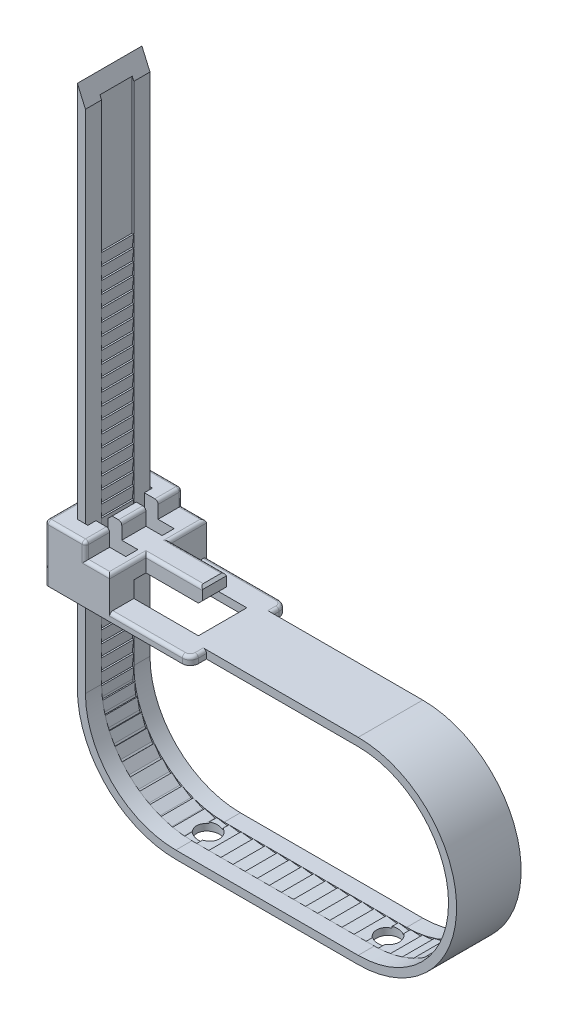
from build123d import *

# Parameters (mm, degrees)
EXTRUDE_1_DEPTH       = 8
SKETCH_2_W            = 18
SKETCH_2_H            = 12
SKETCH_2_W_2          = 1.3
SKETCH_2_H_2          = 8
EXTRUDE_2_DEPTH       = 1
FILLET_1_R            = 1
SKETCH_3_W            = 8
SKETCH_3_H            = 12
EXTRUDE_3_DEPTH       = 4
SKETCH_4_W            = 5
SKETCH_4_H            = 12
SKETCH_4_W_2          = 1.3
SKETCH_4_H_2          = 8
EXTRUDE_4_DEPTH       = 2
CUT_EXTRUDE_START     = -7
CUT_EXTRUDE_1_DEPTH   = 7
SKETCH_6_W            = 12.7
SKETCH_6_H            = 6
CUT_EXTRUDE_2_DEPTH   = 3
SKETCH_7_W            = 3
SKETCH_7_H            = 2
EXTRUDE_5_DEPTH       = 7
CHAMFER_1_SIZE        = 0.3
FILLET_2_R            = 0.4
CHAMFER_2_SIZE        = 0.5
SKETCH_12_W           = 0.2
SKETCH_12_H           = 4
EXTRUDE_6_REACH       = 82.751
PATTERN_START         = 2
PATTERN_CURVE_3_DEPTH = 4
CHAMFER_4_SIZE        = 0.5
CUT_EXTRUDE_3_REACH   = 83.915
SKETCH_15_R           = 1.4


# Read off the part's stored shape, not the designer's step: 曲线阵列3
with BuildPart() as part:
    # 草图1 → 凸台-拉伸1 (new body)
    with BuildSketch(Plane.XY):
        with BuildLine():
            Line((11.3, 0), (-11.3, 0))
            ThreePointArc((-11.3, 0), (-19.219595949, 3.280404051), (-22.5, 11.2))
            Line((-22.5, 11.2), (-22.5, 73.908712153))
            Line((-22.5, 73.908712153), (-23.5, 76.2))
            Line((-23.5, 76.2), (-23.5, 11.2))
            ThreePointArc((-23.5, 11.2), (-19.92670273, 2.57329727), (-11.3, -1))
            Line((-11.3, -1), (11.3, -1))
            ThreePointArc((11.3, -1), (23.5, 11.2), (11.3, 23.4))
            Line((11.3, 23.4), (-7.5, 23.4))
            Line((-7.5, 23.4), (-7.5, 22.4))
            Line((-7.5, 22.4), (11.3, 22.4))
            ThreePointArc((11.3, 22.4), (22.5, 11.2), (11.3, 0))
        make_face()
    extrude(amount=EXTRUDE_1_DEPTH)

    # 草图2 → 凸台-拉伸2 (add)
    with BuildSketch(Plane.XZ.offset(-22.4)):
        with Locations((-16.5, 4)):
            Rectangle(SKETCH_2_W, SKETCH_2_H)
        with Locations((-22.85, 4)):
            Rectangle(SKETCH_2_W_2, SKETCH_2_H_2, mode=Mode.SUBTRACT)
    extrude(amount=-EXTRUDE_2_DEPTH)

    # 圆角1
    fillet_1_edges = [part.edges().sort_by_distance(p)[0] for p in [
        (-7.5, 22.9, 10),
        (-7.5, 22.9, -2),
    ]]
    fillet(fillet_1_edges, radius=FILLET_1_R)

    # 草图3 → 凸台-拉伸3 (add)
    with BuildSketch(Plane(origin=(0, 23.4, 0), x_dir=(1, 0, 0), z_dir=(0, 1, 0))):
        with Locations((-21.5, -4)):
            Rectangle(SKETCH_3_W, SKETCH_3_H)
        Polygon((-22.5, 0), (-22.2, 0), (-22.2, -8), (-22.5, -8), (-23.5, -8), (-23.5, 0), align=None, mode=Mode.SUBTRACT)
    extrude(amount=EXTRUDE_3_DEPTH)

    # 草图4 → 凸台-拉伸4 (add)
    with BuildSketch(Plane(origin=(0, 27.4, 0), x_dir=(1, 0, 0), z_dir=(0, 1, 0))):
        with Locations((-23, -4)):
            Rectangle(SKETCH_4_W, SKETCH_4_H)
        with Locations((-22.85, -4)):
            Rectangle(SKETCH_4_W_2, SKETCH_4_H_2, mode=Mode.SUBTRACT)
    extrude(amount=EXTRUDE_4_DEPTH)

    # 草图5 → 切除-拉伸1 (cut)
    with BuildSketch(Plane(origin=(0, 29.4, 0), x_dir=(1, 0, 0), z_dir=(0, 1, 0)).offset(CUT_EXTRUDE_START)):
        Polygon((-22.2, 0), (-22.5, 0), (-22.5, -8), (-22.2, -8), (-22.2, -7), (-18.5, -7), (-18.5, -5.5), (-22.2, -5.5), (-22.2, -2.5), (-18.5, -2.5), (-18.5, -1), (-22.2, -1), align=None)
    extrude(amount=CUT_EXTRUDE_1_DEPTH, mode=Mode.SUBTRACT)

    # 草图6 → 切除-拉伸2 (cut)
    with BuildSketch(Plane.XZ.offset(-22.4)):
        with Locations((-15.85, 4)):
            Rectangle(SKETCH_6_W, SKETCH_6_H)
    extrude(amount=-CUT_EXTRUDE_2_DEPTH, mode=Mode.SUBTRACT)

    # 草图7 → 凸台-拉伸5 (add)
    with BuildSketch(Plane(origin=(-17.5, 0, 0), x_dir=(0, 0, -1), z_dir=(1, 0, 0))):
        with Locations((-4, 26.4)):
            Rectangle(SKETCH_7_W, SKETCH_7_H)
    extrude(amount=EXTRUDE_5_DEPTH)

    # 倒角1
    chamfer_1_edges = [part.edges().sort_by_distance(p)[0] for p in [
        (-10.5, 27.4, 4),
    ]]
    chamfer(chamfer_1_edges, length=CHAMFER_1_SIZE)

    # 圆角2
    fillet_2_edges = [part.edges().sort_by_distance(p)[0] for p in [
        (-7.5, 23.4, -0.5),
        (-7.792893219, 23.4, -1.707106781),
        (-7.5, 23.4, 8.5),
        (-7.792893219, 23.4, 9.707106781),
        (-25.5, 25.9, 10),
        (-25.5, 25.9, -2),
        (-25.5, 29.4, 4),
        (-20.5, 28.4, 10),
        (-19, 27.4, 10),
        (-23, 29.4, 10),
        (-20.5, 29.4, 8.5),
        (-20.5, 29.4, 4),
        (-20.5, 28.4, -2),
        (-19, 27.4, -2),
        (-23, 29.4, -2),
        (-20.5, 29.4, -0.5),
        (-13, 23.4, -2),
        (-13, 23.4, 10),
        (-14.15, 27.4, 5.5),
        (-14.15, 27.4, 2.5),
        (-17.5, 27.4, 0.25),
        (-17.5, 27.4, 7.75),
    ]]
    fillet(fillet_2_edges, radius=FILLET_2_R)

    # 倒角2
    chamfer_2_edges = [part.edges().sort_by_distance(p)[0] for p in [
        (-10.5, 25.4, 4),
    ]]
    chamfer(chamfer_2_edges, length=CHAMFER_2_SIZE)

    # 切除-扫描3: sweep along a path in 草图11
    with BuildLine(Plane(origin=(0, 0, 0), x_dir=(-1, 0, 0), z_dir=(0, 0, -1))) as sweep_3_path:
        Line((9.562737591, 22.4), (-11.3, 22.4))
        ThreePointArc((-11.3, 22.4), (-22.5, 11.2), (-11.3, 0))
        Line((-11.3, 0), (11.3, 0))
        ThreePointArc((11.3, 0), (19.219595949, 3.280404051), (22.5, 11.2))
        Line((22.5, 11.2), (22.5, 76.2))
    # 草图12 → 切除-扫描3 (sweep, cut)
    with BuildSketch(Plane(origin=(0, 76.2, 0), x_dir=(-1, 0, 0), z_dir=(0, -1, 0))):
        with Locations((22.6, -4)):
            Rectangle(SKETCH_12_W, SKETCH_12_H)
    sweep(path=sweep_3_path.line, mode=Mode.SUBTRACT)

    # 草图14 → 凸台-拉伸6 (add, up to next)
    with BuildSketch(Plane(origin=(0, 0, 6), x_dir=(-1, 0, 0), z_dir=(0, 0, -1)), mode=Mode.PRIVATE) as extrude_6_sk1:
        Polygon((8, 22.6), (8, 22.4), (9.5, 22.6), align=None)
    extrude_6_tool1 = extrude(extrude_6_sk1.sketch, amount=EXTRUDE_6_REACH, mode=Mode.PRIVATE) - part.part
    add(extrude_6_tool1.solids().sort_by_distance((-8.5, 22.533333, 6))[0])

    # 曲线阵列3 outline → 曲线阵列3 (add)
    with BuildSketch(Plane.XY.offset(PATTERN_START)):
        Polygon((-22.7, 57.52124342), (-22.7, 56.02124342), (-22.5, 57.52124342), align=None)
        Polygon((-22.7, 56.02124342), (-22.7, 54.52124342), (-22.5, 56.02124342), align=None)
        Polygon((-22.7, 54.52124342), (-22.7, 53.02124342), (-22.5, 54.52124342), align=None)
        Polygon((-22.7, 53.02124342), (-22.7, 51.52124342), (-22.5, 53.02124342), align=None)
        Polygon((-22.7, 51.52124342), (-22.7, 50.02124342), (-22.5, 51.52124342), align=None)
        Polygon((-22.7, 50.02124342), (-22.7, 48.52124342), (-22.5, 50.02124342), align=None)
        Polygon((-22.7, 48.52124342), (-22.7, 47.02124342), (-22.5, 48.52124342), align=None)
        Polygon((-22.7, 47.02124342), (-22.7, 45.52124342), (-22.5, 47.02124342), align=None)
        Polygon((-22.7, 45.52124342), (-22.7, 44.02124342), (-22.5, 45.52124342), align=None)
        Polygon((-22.7, 44.02124342), (-22.7, 42.52124342), (-22.5, 44.02124342), align=None)
        Polygon((-22.7, 42.52124342), (-22.7, 41.02124342), (-22.5, 42.52124342), align=None)
        Polygon((-22.7, 41.02124342), (-22.7, 39.52124342), (-22.5, 41.02124342), align=None)
        Polygon((-22.7, 39.52124342), (-22.7, 38.02124342), (-22.5, 39.52124342), align=None)
        Polygon((-22.7, 38.02124342), (-22.7, 36.52124342), (-22.5, 38.02124342), align=None)
        Polygon((-22.7, 36.52124342), (-22.7, 35.02124342), (-22.5, 36.52124342), align=None)
        Polygon((-22.7, 35.02124342), (-22.7, 33.52124342), (-22.5, 35.02124342), align=None)
        Polygon((-22.7, 33.52124342), (-22.7, 32.02124342), (-22.5, 33.52124342), align=None)
        Polygon((-22.7, 32.02124342), (-22.7, 30.52124342), (-22.5, 32.02124342), align=None)
        Polygon((-22.7, 30.52124342), (-22.7, 29.02124342), (-22.5, 30.52124342), align=None)
        Polygon((-22.7, 29.02124342), (-22.7, 27.52124342), (-22.5, 29.02124342), align=None)
        Polygon((-22.7, 27.52124342), (-22.7, 26.02124342), (-22.5, 27.52124342), align=None)
        Polygon((-22.7, 26.02124342), (-22.7, 24.52124342), (-22.5, 26.02124342), align=None)
        Polygon((-22.7, 24.52124342), (-22.7, 23.02124342), (-22.5, 24.52124342), align=None)
        Polygon((-22.7, 23.02124342), (-22.7, 21.52124342), (-22.5, 23.02124342), align=None)
        Polygon((-22.7, 21.52124342), (-22.7, 20.02124342), (-22.5, 21.52124342), align=None)
        Polygon((-22.7, 20.02124342), (-22.7, 18.52124342), (-22.5, 20.02124342), align=None)
        Polygon((-22.7, 18.52124342), (-22.7, 17.02124342), (-22.5, 18.52124342), align=None)
        Polygon((-22.7, 17.02124342), (-22.7, 15.52124342), (-22.5, 17.02124342), align=None)
        Polygon((-22.7, 15.52124342), (-22.7, 14.02124342), (-22.5, 15.52124342), align=None)
        Polygon((-22.7, 14.02124342), (-22.7, 12.52124342), (-22.5, 14.02124342), align=None)
        with BuildLine():
            ThreePointArc((-22.7, 11.2), (-22.699685604, 11.115335244), (-22.698742435, 11.030675158))
            Line((-22.698742435, 11.030675158), (-22.5, 12.52124342))
            Line((-22.5, 12.52124342), (-22.7, 12.52124342))
            Line((-22.7, 12.52124342), (-22.7, 11.2))
        make_face()
        with BuildLine():
            ThreePointArc((-22.698404735, 11.009292107), (-22.669244414, 10.363171783), (-22.603488195, 9.719745083))
            Line((-22.603488195, 9.719745083), (-22.509721949, 11.02074092))
            Line((-22.509721949, 11.02074092), (-22.698404735, 11.009292107))
        make_face()
        with BuildLine():
            ThreePointArc((-22.570866688, 9.488987401), (-22.455691986, 8.852546842), (-22.30460878, 8.223662383))
            Line((-22.30460878, 8.223662383), (-22.385402306, 9.525528229))
            Line((-22.385402306, 9.525528229), (-22.570866688, 9.488987401))
        make_face()
        with BuildLine():
            ThreePointArc((-22.241466659, 7.999327046), (-22.042340363, 7.383964944), (-21.808636079, 6.780886089))
            Line((-21.808636079, 6.780886089), (-22.062542361, 8.06030544))
            Line((-22.062542361, 8.06030544), (-22.241466659, 7.999327046))
        make_face()
        with BuildLine():
            ThreePointArc((-21.716104225, 6.566990959), (-21.4365927, 5.983728492), (-21.124452999, 5.417256423))
            Line((-21.124452999, 5.417256423), (-21.546924557, 6.651314792))
            Line((-21.546924557, 6.651314792), (-21.716104225, 6.566990959))
        make_face()
        with BuildLine():
            ThreePointArc((-21.004188664, 5.217632376), (-20.64929798, 4.676915814), (-20.264313304, 4.157196084))
            Line((-20.264313304, 4.157196084), (-20.847783644, 5.323791403))
            Line((-20.847783644, 5.323791403), (-21.004188664, 5.217632376))
        make_face()
        with BuildLine():
            ThreePointArc((-20.118470429, 3.9754184), (-19.694556703, 3.486932012), (-19.243622154, 3.023272837))
            Line((-19.243622154, 3.023272837), (-19.977641284, 4.101511305))
            Line((-19.977641284, 4.101511305), (-20.118470429, 3.9754184))
        make_face()
        with BuildLine():
            ThreePointArc((-19.074812796, 2.862597166), (-18.58946835, 2.435089778), (-18.080660196, 2.035795325))
            Line((-18.080660196, 2.035795325), (-18.952081783, 3.006365618))
            Line((-18.952081783, 3.006365618), (-19.074812796, 2.862597166))
        make_face()
        with BuildLine():
            ThreePointArc((-17.89190774, 1.899099379), (-17.353825127, 1.540227677), (-16.796256157, 1.212449336))
            Line((-16.796256157, 1.212449336), (-17.789472982, 2.057968474))
            Line((-17.789472982, 2.057968474), (-17.89190774, 1.899099379))
        make_face()
        with BuildLine():
            ThreePointArc((-16.590941174, 1.102181349), (-16.00975749, 0.818372748), (-15.4134138, 0.567981052))
            Line((-15.4134138, 0.567981052), (-16.510637283, 1.273305731))
            Line((-16.510637283, 1.273305731), (-16.590941174, 1.102181349))
        make_face()
        with BuildLine():
            ThreePointArc((-15.195213495, 0.486115931), (-14.581337778, 0.282453463), (-13.956899925, 0.113932943))
            Line((-13.956899925, 0.113932943), (-15.138478719, 0.666430751))
            Line((-15.138478719, 0.666430751), (-15.195213495, 0.486115931))
        make_face()
        with BuildLine():
            ThreePointArc((-13.729722281, 0.061936899), (-13.094149086, -0.057931829), (-12.452800793, -0.141562958))
            Line((-12.452800793, -0.141562958), (-13.697572743, 0.248212706))
            Line((-13.697572743, 0.248212706), (-13.729722281, 0.061936899))
        make_face()
        with BuildLine():
            Line((-11.3, -0.2), (-10.892597895, -0.2))
            Line((-10.892597895, -0.2), (-12.213726078, 0.026141908))
            Line((-12.213726078, 0.026141908), (-12.220714576, -0.162758674))
            ThreePointArc((-12.220714576, -0.162758674), (-11.760733721, -0.190685863), (-11.3, -0.2))
        make_face()
        Polygon((-10.71416228, -0.2), (-9.21416228, -0.2), (-10.71416228, 0), align=None)
        Polygon((-9.21416228, -0.2), (-7.71416228, -0.2), (-9.21416228, 0), align=None)
        Polygon((-7.71416228, -0.2), (-6.21416228, -0.2), (-7.71416228, 0), align=None)
        Polygon((-6.21416228, -0.2), (-4.71416228, -0.2), (-6.21416228, 0), align=None)
        Polygon((-4.71416228, -0.2), (-3.21416228, -0.2), (-4.71416228, 0), align=None)
        Polygon((-3.21416228, -0.2), (-1.71416228, -0.2), (-3.21416228, 0), align=None)
        Polygon((-1.71416228, -0.2), (-0.21416228, -0.2), (-1.71416228, 0), align=None)
        Polygon((-0.21416228, -0.2), (1.28583772, -0.2), (-0.21416228, 0), align=None)
        Polygon((1.28583772, -0.2), (2.78583772, -0.2), (1.28583772, 0), align=None)
        Polygon((2.78583772, -0.2), (4.28583772, -0.2), (2.78583772, 0), align=None)
        Polygon((4.28583772, -0.2), (5.78583772, -0.2), (4.28583772, 0), align=None)
        Polygon((5.78583772, -0.2), (7.28583772, -0.2), (5.78583772, 0), align=None)
        Polygon((7.28583772, -0.2), (8.78583772, -0.2), (7.28583772, 0), align=None)
        Polygon((8.78583772, -0.2), (10.28583772, -0.2), (8.78583772, 0), align=None)
        with BuildLine():
            ThreePointArc((11.3, -0.2), (11.513084401, -0.19800838), (11.726094349, -0.192034217))
            Line((11.726094349, -0.192034217), (10.28583772, 0))
            Line((10.28583772, 0), (10.28583772, -0.2))
            Line((10.28583772, -0.2), (11.3, -0.2))
        make_face()
        with BuildLine():
            ThreePointArc((11.803118054, -0.188892493), (12.448196118, -0.142030051), (13.089578311, -0.05865931))
            Line((13.089578311, -0.05865931), (11.786500895, -0.000594488))
            Line((11.786500895, -0.000594488), (11.803118054, -0.188892493))
        make_face()
        with BuildLine():
            ThreePointArc((13.31935496, -0.019723951), (13.952398855, 0.112855177), (14.576905074, 0.281122167))
            Line((14.576905074, 0.281122167), (13.277743449, 0.164668974))
            Line((13.277743449, 0.164668974), (13.31935496, -0.019723951))
        make_face()
        with BuildLine():
            ThreePointArc((14.799425084, 0.350390602), (15.40909695, 0.566311916), (16.005542247, 0.816461482))
            Line((16.005542247, 0.816461482), (14.733564484, 0.527575958))
            Line((14.733564484, 0.527575958), (14.799425084, 0.350390602))
        make_face()
        with BuildLine():
            ThreePointArc((16.216820268, 0.914822391), (16.792200841, 1.210218725), (17.349902841, 1.537770671))
            Line((17.349902841, 1.537770671), (16.127890148, 1.081626775))
            Line((16.127890148, 1.081626775), (16.216820268, 0.914822391))
        make_face()
        with BuildLine():
            ThreePointArc((17.546154871, 1.663462403), (18.076939046, 2.033043189), (18.585909268, 2.432131038))
            Line((18.585909268, 2.432131038), (17.435747974, 1.816898338))
            Line((17.435747974, 1.816898338), (17.546154871, 1.663462403))
        make_face()
        with BuildLine():
            ThreePointArc((18.763620418, 2.582902446), (19.240301815, 3.020048467), (19.691424569, 3.483524528))
            Line((19.691424569, 3.483524528), (18.633714141, 2.720221884))
            Line((18.633714141, 2.720221884), (18.763620418, 2.582902446))
        make_face()
        with BuildLine():
            ThreePointArc((19.847412022, 3.656675287), (20.261453245, 4.153557228), (20.646648891, 4.673120614))
            Line((20.646648891, 4.673120614), (19.700332994, 3.775418827))
            Line((19.700332994, 3.775418827), (19.847412022, 3.656675287))
        make_face()
        with BuildLine():
            ThreePointArc((20.7781189, 4.865549581), (21.122104443, 5.413268253), (21.434474101, 5.97961355))
            Line((21.434474101, 5.97961355), (20.616501317, 4.963590519))
            Line((20.616501317, 4.963590519), (20.7781189, 4.865549581))
        make_face()
        with BuildLine():
            ThreePointArc((21.539072031, 6.187874309), (21.806841089, 6.776620034), (22.040790198, 7.379603958))
            Line((22.040790198, 7.379603958), (21.365810474, 6.263456725))
            Line((21.365810474, 6.263456725), (21.539072031, 6.187874309))
        make_face()
        with BuildLine():
            ThreePointArc((22.116642692, 7.599966546), (22.303399504, 8.219194849), (22.454738019, 8.848017917))
            Line((22.454738019, 8.848017917), (21.934840287, 7.651736753))
            Line((21.934840287, 7.651736753), (22.116642692, 7.599966546))
        make_face()
        with BuildLine():
            ThreePointArc((22.500486554, 9.076535624), (22.602886293, 9.715156083), (22.668903731, 10.358556033))
            Line((22.668903731, 10.358556033), (22.313399395, 9.103566415))
            Line((22.313399395, 9.103566415), (22.500486554, 9.076535624))
        make_face()
        with BuildLine():
            ThreePointArc((22.683728947, 10.591136092), (22.699937626, 11.237710973), (22.679451612, 11.884164468))
            Line((22.679451612, 11.884164468), (22.494707777, 10.592943344))
            Line((22.494707777, 10.592943344), (22.683728947, 10.591136092))
        make_face()
        with BuildLine():
            ThreePointArc((22.663087988, 12.116641354), (22.592815309, 12.759590456), (22.486192747, 13.39751947))
            Line((22.486192747, 13.39751947), (22.47551819, 12.093192698))
            Line((22.47551819, 12.093192698), (22.663087988, 12.116641354))
        make_face()
        with BuildLine():
            ThreePointArc((22.438933358, 13.625729507), (22.28343791, 14.253537569), (22.092588417, 14.871516751))
            Line((22.092588417, 14.871516751), (22.256174318, 13.577444911))
            Line((22.256174318, 13.577444911), (22.438933358, 13.625729507))
        make_face()
        with BuildLine():
            ThreePointArc((22.015279681, 15.091372682), (21.777346397, 15.69279562), (21.505688102, 16.27975692))
            Line((21.505688102, 16.27975692), (21.840604627, 15.019116925))
            Line((21.840604627, 15.019116925), (22.015279681, 15.091372682))
        make_face()
        with BuildLine():
            ThreePointArc((21.399714624, 16.487321109), (21.083604905, 17.051587397), (20.736003225, 17.5970183))
            Line((20.736003225, 17.5970183), (21.236251998, 16.392388298))
            Line((21.236251998, 16.392388298), (21.399714624, 16.487321109))
        make_face()
        with BuildLine():
            ThreePointArc((20.603262997, 17.78857326), (20.21463839, 18.305576851), (19.797318895, 18.799708652))
            Line((19.797318895, 18.799708652), (20.453940425, 17.672663647))
            Line((20.453940425, 17.672663647), (20.603262997, 17.78857326))
        make_face()
        with BuildLine():
            ThreePointArc((19.640189304, 18.97182362), (19.186010101, 19.432304943), (18.706447012, 19.866287709))
            Line((18.706447012, 19.866287709), (19.507681163, 18.837013154))
            Line((19.507681163, 18.837013154), (19.640189304, 18.97182362))
        make_face()
        with BuildLine():
            ThreePointArc((18.527742258, 20.015880095), (18.01614284, 20.411591901), (17.482925163, 20.777652971))
            Line((17.482925163, 20.777652971), (18.414421779, 19.864583242))
            Line((18.414421779, 19.864583242), (18.527742258, 20.015880095))
        make_face()
        with BuildLine():
            ThreePointArc((17.285845862, 20.902043564), (16.725989009, 21.225898627), (16.148666709, 21.517481822))
            Line((16.148666709, 21.517481822), (17.193742622, 20.736970059))
            Line((17.193742622, 20.736970059), (17.285845862, 20.902043564))
        make_face()
        with BuildLine():
            ThreePointArc((15.936742563, 21.614442779), (15.338655349, 21.860640833), (14.727568307, 22.072523879))
            Line((14.727568307, 22.072523879), (15.867506137, 21.438549101))
            Line((15.867506137, 21.438549101), (15.936742563, 21.614442779))
        make_face()
        with BuildLine():
            ThreePointArc((14.504594893, 22.140318623), (13.8789891, 22.304450244), (13.245081926, 22.432838301))
            Line((13.245081926, 22.432838301), (14.459465309, 21.956755039))
            Line((14.459465309, 21.956755039), (14.504594893, 22.140318623))
        make_face()
        with BuildLine():
            ThreePointArc((13.015052712, 22.470252623), (12.373132981, 22.549378203), (11.727758996, 22.591971833))
            Line((11.727758996, 22.591971833), (12.994838246, 22.282306769))
            Line((12.994838246, 22.282306769), (13.015052712, 22.470252623))
        make_face()
        with BuildLine():
            Line((11.3, 22.6), (10, 22.6))
            Line((10, 22.6), (11.5, 22.4))
            Line((11.5, 22.4), (11.5, 22.598245479))
            ThreePointArc((11.5, 22.598245479), (11.400003848, 22.599561361), (11.3, 22.6))
        make_face()
        Polygon((10, 22.6), (8.5, 22.6), (10, 22.4), align=None)
        Polygon((8.5, 22.6), (7, 22.6), (8.5, 22.4), align=None)
        Polygon((7, 22.6), (5.5, 22.6), (7, 22.4), align=None)
        Polygon((5.5, 22.6), (4, 22.6), (5.5, 22.4), align=None)
        Polygon((4, 22.6), (2.5, 22.6), (4, 22.4), align=None)
        Polygon((2.5, 22.6), (1, 22.6), (2.5, 22.4), align=None)
        Polygon((1, 22.6), (-0.5, 22.6), (1, 22.4), align=None)
        Polygon((-0.5, 22.6), (-2, 22.6), (-0.5, 22.4), align=None)
        Polygon((-2, 22.6), (-3.5, 22.6), (-2, 22.4), align=None)
        Polygon((-3.5, 22.6), (-5, 22.6), (-3.5, 22.4), align=None)
        Polygon((-5, 22.6), (-6.5, 22.6), (-5, 22.4), align=None)
        Polygon((-8, 22.6), (-6.5, 22.4), (-6.5, 22.6), align=None)
    extrude(amount=PATTERN_CURVE_3_DEPTH)

    # 倒角4
    chamfer_4_edges = [part.edges().sort_by_distance(p)[0] for p in [
        (-22.2, 29.4, 4),
    ]]
    chamfer(chamfer_4_edges, length=CHAMFER_4_SIZE)

    # 草图15 → 切除-拉伸3 (cut, up to next)
    with BuildSketch(Plane.XZ.offset(1), mode=Mode.PRIVATE) as cut_extrude_3_sk1:
        with Locations(Location((11, 4, 0), (0, 0, 282.373625116))):
            Circle(SKETCH_15_R)
    cut_extrude_3_tool1 = extrude(cut_extrude_3_sk1.sketch, amount=-CUT_EXTRUDE_3_REACH, mode=Mode.PRIVATE) & part.part
    # 草图15 → 切除-拉伸3 (cut, up to next)
    with BuildSketch(Plane.XZ.offset(1), mode=Mode.PRIVATE) as cut_extrude_3_sk2:
        with Locations(Location((-11.3, 4, 0), (0, 0, 270))):
            Circle(SKETCH_15_R)
    cut_extrude_3_tool2 = extrude(cut_extrude_3_sk2.sketch, amount=-CUT_EXTRUDE_3_REACH, mode=Mode.PRIVATE) & part.part
    add(cut_extrude_3_tool1.solids().sort_by_distance((11, -1, 4))[0], mode=Mode.SUBTRACT)
    add(cut_extrude_3_tool2.solids().sort_by_distance((-11.3, -1, 4))[0], mode=Mode.SUBTRACT)


solid = part.part
